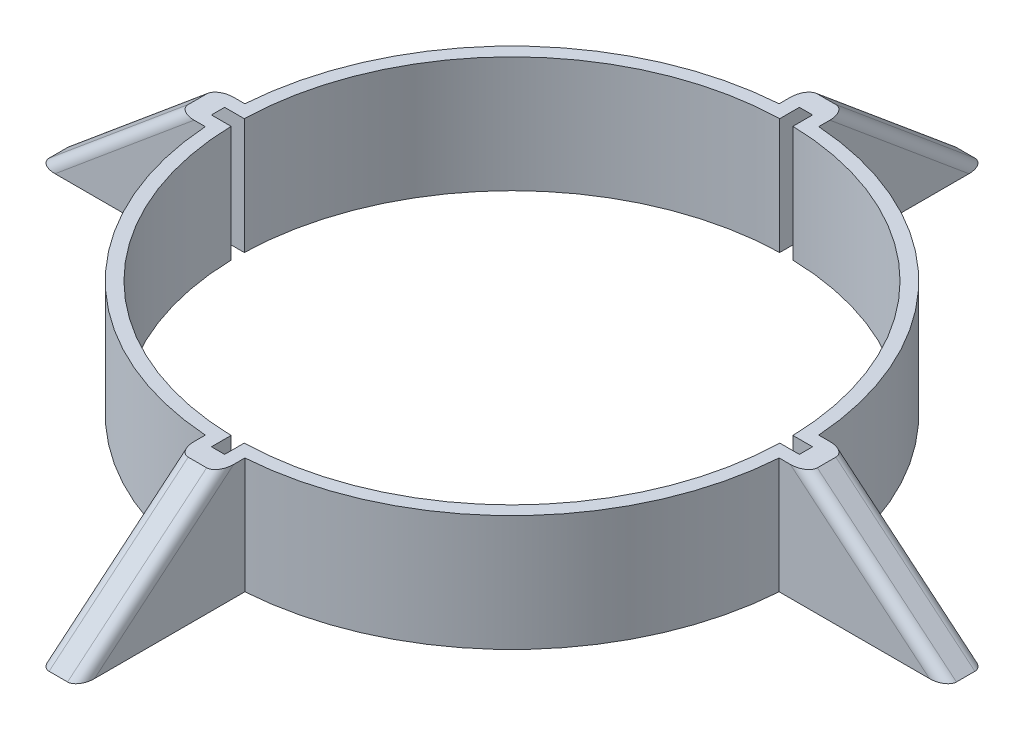
from build123d import *

# Parameters (mm, degrees)
SKETCH4_R                      = 69.215
SKETCH4_R_2                    = 66.04
BOSS_EXTRUDE3_DEPTH            = 114.3
CUT_EXTRUDE3_REACH             = 152.486
CUT_EXTRUDE3_END_RADIUS        = 69.215
SKETCH11_W                     = 3.175
SKETCH11_H                     = 203.2
CUT_EXTRUDE3_DIRECTION_2_DEPTH = 151.485622071
CUT_EXTRUDE4_REACH             = 152.486
CUT_EXTRUDE4_END_RADIUS        = 69.215
SKETCH12_W                     = 3.175
SKETCH12_H                     = 203.2
CUT_EXTRUDE5_REACH             = 152.486
CUT_EXTRUDE5_END_RADIUS        = 69.215
SKETCH13_W                     = 3.175
SKETCH13_H                     = 203.2
BOSS_EXTRUDE4_REACH            = 184.577
BOSS_EXTRUDE4_END_RADIUS       = 69.215
SKETCH17_W                     = 9.525
SKETCH17_H                     = 62.726737768
CUT_EXTRUDE6_REACH             = 184.577
CUT_EXTRUDE6_END_RADIUS        = 66.04
SKETCH19_W                     = 3.175
SKETCH19_H                     = 59.551737768
CIRPATTERN1_COUNT              = 4
FILLET2_R                      = 2.54
CUT_EXTRUDE9_DEPTH             = 193.329009636
CUT_EXTRUDE9_DEPTH_BACK        = 193.329009636
SKETCH21_W                     = 275.590003483
SKETCH21_H                     = 18.263028837
SKETCH21_H_2                   = 74.818808086


with BuildPart() as part:
    # Sketch4 → Boss-Extrude3 (new body)
    with BuildSketch(Plane(origin=(0, 0, 0), x_dir=(1, 0, 0), z_dir=(0, 1, 0))):
        with Locations(Location((0, 0, 0), (0, 0, 270))):
            Circle(SKETCH4_R)
        with Locations(Location((0, 0, 0), (0, 0, 270))):
            Circle(SKETCH4_R_2, mode=Mode.SUBTRACT)
    extrude(amount=BOSS_EXTRUDE3_DEPTH)

    # Cut-Extrude3: up to this cylinder (the profile starts inside it)
    cut_extrude3_end = Plane(origin=(0, 0, 0), z_dir=(0, -1, 0)) * Cylinder(CUT_EXTRUDE3_END_RADIUS, 444.402, mode=Mode.PRIVATE)
    # Sketch11 → Cut-Extrude3 (cut, up to the surface)
    with BuildSketch(Plane.XY, mode=Mode.PRIVATE) as cut_extrude3_sk1:
        Rectangle(SKETCH11_W, SKETCH11_H)
    cut_extrude3_tool1 = extrude(cut_extrude3_sk1.sketch, amount=-CUT_EXTRUDE3_REACH, mode=Mode.PRIVATE) & cut_extrude3_end
    add(cut_extrude3_tool1.solids().sort_by_distance((0, 0, 0))[0], mode=Mode.SUBTRACT)

    # Sketch11 → Cut-Extrude3 direction 2 (cut)
    with BuildSketch(Plane.XY):
        Rectangle(SKETCH11_W, SKETCH11_H)
    extrude(amount=CUT_EXTRUDE3_DIRECTION_2_DEPTH, mode=Mode.SUBTRACT)

    # Cut-Extrude4: up to this cylinder (the profile starts inside it)
    cut_extrude4_end = Plane(origin=(0, 0, 0), z_dir=(0, -1, 0)) * Cylinder(CUT_EXTRUDE4_END_RADIUS, 444.402, mode=Mode.PRIVATE)
    # Sketch12 → Cut-Extrude4 (cut, up to the surface)
    with BuildSketch(Plane(origin=(0, 0, 0), x_dir=(0, 0, -1), z_dir=(1, 0, 0)), mode=Mode.PRIVATE) as cut_extrude4_sk1:
        Rectangle(SKETCH12_W, SKETCH12_H)
    cut_extrude4_tool1 = extrude(cut_extrude4_sk1.sketch, amount=-CUT_EXTRUDE4_REACH, mode=Mode.PRIVATE) & cut_extrude4_end
    add(cut_extrude4_tool1.solids().sort_by_distance((0, 0, 0))[0], mode=Mode.SUBTRACT)

    # Cut-Extrude5: up to this cylinder (the profile starts inside it)
    cut_extrude5_end = Plane(origin=(0, 0, 0), z_dir=(0, -1, 0)) * Cylinder(CUT_EXTRUDE5_END_RADIUS, 444.402, mode=Mode.PRIVATE)
    # Sketch13 → Cut-Extrude5 (cut, up to the surface)
    with BuildSketch(Plane(origin=(0, 0, 0), x_dir=(0, 0, -1), z_dir=(1, 0, 0)), mode=Mode.PRIVATE) as cut_extrude5_sk1:
        Rectangle(SKETCH13_W, SKETCH13_H)
    cut_extrude5_tool1 = extrude(cut_extrude5_sk1.sketch, amount=CUT_EXTRUDE5_REACH, mode=Mode.PRIVATE) & cut_extrude5_end
    add(cut_extrude5_tool1.solids().sort_by_distance((0, 0, 0))[0], mode=Mode.SUBTRACT)

    # Boss-Extrude4: up to this cylinder (the profile starts outside it)
    boss_extrude4_end = Plane(origin=(0, 49.492455, 0), z_dir=(0, -1, 0)) * Cylinder(BOSS_EXTRUDE4_END_RADIUS, 508.584, mode=Mode.PRIVATE)
    # Sketch17 → Boss-Extrude4 (add, up to the surface)
    with BuildSketch(Plane(origin=(28.35077692, -23.629361026, 0), x_dir=(0, 0, -1), z_dir=(0.7681717916741627, -0.6402437805056029, 0)), mode=Mode.PRIVATE) as boss_extrude4_sk1:
        with Locations((0, 95.18940566)):
            Rectangle(SKETCH17_W, SKETCH17_H)
    boss_extrude4_tool1 = extrude(boss_extrude4_sk1.sketch, amount=-BOSS_EXTRUDE4_REACH, mode=Mode.PRIVATE) - boss_extrude4_end
    boss_extrude4 = boss_extrude4_tool1.solids().sort_by_distance((89.295202, 49.492455, 0))[0]
    add(boss_extrude4)

    # Cut-Extrude6: up to this cylinder (the profile starts outside it)
    cut_extrude6_end = Plane(origin=(0, 48.272983, 0), z_dir=(0, -1, 0)) * Cylinder(CUT_EXTRUDE6_END_RADIUS, 502.234, mode=Mode.PRIVATE)
    # Sketch19 → Cut-Extrude6 (cut, up to the surface)
    with BuildSketch(Plane(origin=(28.35077692, -23.629361026, 0), x_dir=(0, 0, -1), z_dir=(0.7681717916741628, -0.640243780505603, 0)), mode=Mode.PRIVATE) as cut_extrude6_sk1:
        with Locations((0, 93.60190566)):
            Rectangle(SKETCH19_W, SKETCH19_H)
    cut_extrude6_tool1 = extrude(cut_extrude6_sk1.sketch, amount=-CUT_EXTRUDE6_REACH, mode=Mode.PRIVATE) - cut_extrude6_end
    cut_extrude6 = cut_extrude6_tool1.solids().sort_by_distance((88.278815, 48.272983, 0))[0]
    add(cut_extrude6, mode=Mode.SUBTRACT)

    # CirPattern1: Boss-Extrude4, Cut-Extrude6 ×4 about axis
    cirpattern1_axis = Axis((0, 0, 0), (0, 1, 0))
    add([boss_extrude4.rotate(cirpattern1_axis, i * 360 / CIRPATTERN1_COUNT) for i in range(1, CIRPATTERN1_COUNT)])
    add([cut_extrude6.rotate(cirpattern1_axis, i * 360 / CIRPATTERN1_COUNT) for i in range(1, CIRPATTERN1_COUNT)], mode=Mode.SUBTRACT)

    # Fillet2
    # the kernel refuses this fillet: 2.54 mm, written as the material it takes off along each edge
    with BuildSketch(Plane(origin=(4.7625, 20.522109123, -65.149451994), x_dir=(-1, 0, 0), z_dir=(0, 0.7681717916741628, -0.640243780505603))) as fillet2_piece_1_section:
        with BuildLine():
            CenterArc((FILLET2_R, FILLET2_R), FILLET2_R, 180, 90)
            Line((0, FILLET2_R), (0, 0))
            Line((0, 0), (FILLET2_R, 0))
        make_face()
    fillet2_piece_1 = extrude(amount=75.426737768, mode=Mode.PRIVATE)
    fillet2_piece_1 = fillet2_piece_1 - Plane(origin=(0, 52.481761508, 0), x_dir=(0, 0, 1), z_dir=(0, -1, 0)) * Cylinder(69.215, 162, mode=Mode.PRIVATE)
    add(fillet2_piece_1, mode=Mode.SUBTRACT)
    with BuildSketch(Plane(origin=(4.7625, 69.519362531, -114.253294604), x_dir=(0, -0.7681717916741627, 0.640243780505603), z_dir=(0, 0.640243780505603, 0.7681717916741628))) as fillet2_piece_2_section:
        with BuildLine():
            CenterArc((FILLET2_R, -FILLET2_R), FILLET2_R, 90, 90)
            Line((0, -FILLET2_R), (0, 0))
            Line((0, 0), (FILLET2_R, 0))
        make_face()
    fillet2_piece_2 = extrude(amount=65.194046298, mode=Mode.PRIVATE)
    fillet2_piece_2 = fillet2_piece_2 - Plane(origin=(0, 87.751002434, 0), x_dir=(0, 0, 1), z_dir=(0, -1, 0)) * Cylinder(69.215, 141, mode=Mode.PRIVATE)
    add(fillet2_piece_2, mode=Mode.SUBTRACT)
    with BuildSketch(Plane(origin=(-4.7625, 78.462801414, -113.440951733), x_dir=(1, 0, 0), z_dir=(0, -0.7681717916741628, 0.640243780505603))) as fillet2_piece_3_section:
        with BuildLine():
            CenterArc((FILLET2_R, FILLET2_R), FILLET2_R, 180, 90)
            Line((0, FILLET2_R), (0, 0))
            Line((0, 0), (FILLET2_R, 0))
        make_face()
    fillet2_piece_3 = extrude(amount=75.426737768, mode=Mode.PRIVATE)
    fillet2_piece_3 = fillet2_piece_3 - Plane(origin=(0, 52.481717746, 0), x_dir=(0, 0, 1), z_dir=(0, -1, 0)) * Cylinder(69.215, 162, mode=Mode.PRIVATE)
    add(fillet2_piece_3, mode=Mode.SUBTRACT)
    with BuildSketch(Plane(origin=(-4.7625, 69.519362531, -114.253294604), x_dir=(1, 0, 0), z_dir=(0, 0.640243780505603, 0.7681717916741628))) as fillet2_piece_4_section:
        with BuildLine():
            CenterArc((FILLET2_R, -FILLET2_R), FILLET2_R, 90, 90)
            Line((0, -FILLET2_R), (0, 0))
            Line((0, 0), (FILLET2_R, 0))
        make_face()
    fillet2_piece_4 = extrude(amount=65.194046298, mode=Mode.PRIVATE)
    fillet2_piece_4 = fillet2_piece_4 - Plane(origin=(0, 87.75098251, 0), x_dir=(0, 0, 1), z_dir=(0, -1, 0)) * Cylinder(69.215, 141, mode=Mode.PRIVATE)
    add(fillet2_piece_4, mode=Mode.SUBTRACT)
    with BuildSketch(Plane(origin=(-113.440951733, 78.462801414, 4.7625), x_dir=(0.7681717916741627, 0.640243780505603, 0), z_dir=(0.640243780505603, -0.7681717916741628, 0))) as fillet2_piece_5_section:
        with BuildLine():
            CenterArc((FILLET2_R, -FILLET2_R), FILLET2_R, 90, 90)
            Line((0, -FILLET2_R), (0, 0))
            Line((0, 0), (FILLET2_R, 0))
        make_face()
    fillet2_piece_5 = extrude(amount=75.426737768, mode=Mode.PRIVATE)
    fillet2_piece_5 = fillet2_piece_5 - Plane(origin=(0, 52.481803849, 0), x_dir=(0, 0, 1), z_dir=(0, -1, 0)) * Cylinder(69.215, 162, mode=Mode.PRIVATE)
    add(fillet2_piece_5, mode=Mode.SUBTRACT)
    with BuildSketch(Plane(origin=(-65.149451994, 20.522109123, -4.7625), x_dir=(0.7681717916741627, 0.6402437805056029, 0), z_dir=(-0.640243780505603, 0.7681717916741628, 0))) as fillet2_piece_6_section:
        with BuildLine():
            CenterArc((FILLET2_R, -FILLET2_R), FILLET2_R, 90, 90)
            Line((0, -FILLET2_R), (0, 0))
            Line((0, 0), (FILLET2_R, 0))
        make_face()
    fillet2_piece_6 = extrude(amount=75.426737768, mode=Mode.PRIVATE)
    fillet2_piece_6 = fillet2_piece_6 - Plane(origin=(0, 52.481712427, 0), x_dir=(0, 0, 1), z_dir=(0, -1, 0)) * Cylinder(69.215, 162, mode=Mode.PRIVATE)
    add(fillet2_piece_6, mode=Mode.SUBTRACT)
    with BuildSketch(Plane(origin=(-114.253294604, 69.519362531, -4.7625), x_dir=(0.640243780505603, -0.7681717916741627, 0), z_dir=(0.7681717916741628, 0.640243780505603, 0))) as fillet2_piece_7_section:
        with BuildLine():
            CenterArc((FILLET2_R, -FILLET2_R), FILLET2_R, 90, 90)
            Line((0, -FILLET2_R), (0, 0))
            Line((0, 0), (FILLET2_R, 0))
        make_face()
    fillet2_piece_7 = extrude(amount=65.194046298, mode=Mode.PRIVATE)
    fillet2_piece_7 = fillet2_piece_7 - Plane(origin=(0, 87.75099738, 0), x_dir=(0, 0, 1), z_dir=(0, -1, 0)) * Cylinder(69.215, 141, mode=Mode.PRIVATE)
    add(fillet2_piece_7, mode=Mode.SUBTRACT)
    with BuildSketch(Plane(origin=(-114.253294604, 69.519362531, 4.7625), x_dir=(0, 0, -1), z_dir=(0.7681717916741628, 0.640243780505603, 0))) as fillet2_piece_8_section:
        with BuildLine():
            CenterArc((FILLET2_R, -FILLET2_R), FILLET2_R, 90, 90)
            Line((0, -FILLET2_R), (0, 0))
            Line((0, 0), (FILLET2_R, 0))
        make_face()
    fillet2_piece_8 = extrude(amount=65.194046298, mode=Mode.PRIVATE)
    fillet2_piece_8 = fillet2_piece_8 - Plane(origin=(0, 87.75098251, 0), x_dir=(0, 0, 1), z_dir=(0, -1, 0)) * Cylinder(69.215, 141, mode=Mode.PRIVATE)
    add(fillet2_piece_8, mode=Mode.SUBTRACT)
    with BuildSketch(Plane(origin=(4.7625, 78.462801414, 113.440951733), x_dir=(0, 0.640243780505603, -0.7681717916741628), z_dir=(0, -0.7681717916741628, -0.640243780505603))) as fillet2_piece_9_section:
        with BuildLine():
            CenterArc((FILLET2_R, -FILLET2_R), FILLET2_R, 90, 90)
            Line((0, -FILLET2_R), (0, 0))
            Line((0, 0), (FILLET2_R, 0))
        make_face()
    fillet2_piece_9 = extrude(amount=75.426737768, mode=Mode.PRIVATE)
    fillet2_piece_9 = fillet2_piece_9 - Plane(origin=(0, 52.48180385, 0), x_dir=(0, 0, 1), z_dir=(0, -1, 0)) * Cylinder(69.215, 162, mode=Mode.PRIVATE)
    add(fillet2_piece_9, mode=Mode.SUBTRACT)
    with BuildSketch(Plane(origin=(-4.7625, 20.522109123, 65.149451994), x_dir=(0, 0.640243780505603, -0.7681717916741628), z_dir=(0, 0.7681717916741628, 0.640243780505603))) as fillet2_piece_10_section:
        with BuildLine():
            CenterArc((FILLET2_R, -FILLET2_R), FILLET2_R, 90, 90)
            Line((0, -FILLET2_R), (0, 0))
            Line((0, 0), (FILLET2_R, 0))
        make_face()
    fillet2_piece_10 = extrude(amount=75.426737768, mode=Mode.PRIVATE)
    fillet2_piece_10 = fillet2_piece_10 - Plane(origin=(0, 52.481712427, 0), x_dir=(0, 0, 1), z_dir=(0, -1, 0)) * Cylinder(69.215, 162, mode=Mode.PRIVATE)
    add(fillet2_piece_10, mode=Mode.SUBTRACT)
    with BuildSketch(Plane(origin=(-4.7625, 69.519362531, 114.253294604), x_dir=(0, -0.7681717916741627, -0.640243780505603), z_dir=(0, 0.640243780505603, -0.7681717916741628))) as fillet2_piece_11_section:
        with BuildLine():
            CenterArc((FILLET2_R, -FILLET2_R), FILLET2_R, 90, 90)
            Line((0, -FILLET2_R), (0, 0))
            Line((0, 0), (FILLET2_R, 0))
        make_face()
    fillet2_piece_11 = extrude(amount=65.194046298, mode=Mode.PRIVATE)
    fillet2_piece_11 = fillet2_piece_11 - Plane(origin=(0, 87.750997379, 0), x_dir=(0, 0, 1), z_dir=(0, -1, 0)) * Cylinder(69.215, 141, mode=Mode.PRIVATE)
    add(fillet2_piece_11, mode=Mode.SUBTRACT)
    with BuildSketch(Plane(origin=(4.7625, 69.519362531, 114.253294604), x_dir=(-1, 0, 0), z_dir=(0, 0.640243780505603, -0.7681717916741628))) as fillet2_piece_12_section:
        with BuildLine():
            CenterArc((FILLET2_R, -FILLET2_R), FILLET2_R, 90, 90)
            Line((0, -FILLET2_R), (0, 0))
            Line((0, 0), (FILLET2_R, 0))
        make_face()
    fillet2_piece_12 = extrude(amount=65.194046298, mode=Mode.PRIVATE)
    fillet2_piece_12 = fillet2_piece_12 - Plane(origin=(0, 87.750982502, 0), x_dir=(0, 0, 1), z_dir=(0, -1, 0)) * Cylinder(69.215, 141, mode=Mode.PRIVATE)
    add(fillet2_piece_12, mode=Mode.SUBTRACT)
    with BuildSketch(Plane(origin=(114.253294604, 69.519362531, -4.7625), x_dir=(-0.6402437805056029, -0.7681717916741627, 0), z_dir=(-0.7681717916741628, 0.640243780505603, 0))) as fillet2_piece_13_section:
        with BuildLine():
            CenterArc((FILLET2_R, FILLET2_R), FILLET2_R, 180, 90)
            Line((0, FILLET2_R), (0, 0))
            Line((0, 0), (FILLET2_R, 0))
        make_face()
    fillet2_piece_13 = extrude(amount=65.194046298, mode=Mode.PRIVATE)
    fillet2_piece_13 = fillet2_piece_13 - Plane(origin=(0, 87.750998227, 0), x_dir=(0, 0, 1), z_dir=(0, -1, 0)) * Cylinder(69.215, 141, mode=Mode.PRIVATE)
    add(fillet2_piece_13, mode=Mode.SUBTRACT)
    with BuildSketch(Plane(origin=(114.253294604, 69.519362531, 4.7625), x_dir=(0, 0, -1), z_dir=(-0.7681717916741628, 0.640243780505603, 0))) as fillet2_piece_14_section:
        with BuildLine():
            CenterArc((FILLET2_R, FILLET2_R), FILLET2_R, 180, 90)
            Line((0, FILLET2_R), (0, 0))
            Line((0, 0), (FILLET2_R, 0))
        make_face()
    fillet2_piece_14 = extrude(amount=65.194046298, mode=Mode.PRIVATE)
    fillet2_piece_14 = fillet2_piece_14 - Plane(origin=(0, 87.7510067, 0), x_dir=(0, 0, 1), z_dir=(0, -1, 0)) * Cylinder(69.215, 141, mode=Mode.PRIVATE)
    add(fillet2_piece_14, mode=Mode.SUBTRACT)
    with BuildSketch(Plane(origin=(65.149451994, 20.522109123, 4.7625), x_dir=(-0.7681717916741627, 0.6402437805056029, 0), z_dir=(0.640243780505603, 0.7681717916741628, 0))) as fillet2_piece_15_section:
        with BuildLine():
            CenterArc((FILLET2_R, -FILLET2_R), FILLET2_R, 90, 90)
            Line((0, -FILLET2_R), (0, 0))
            Line((0, 0), (FILLET2_R, 0))
        make_face()
    fillet2_piece_15 = extrude(amount=75.426737768, mode=Mode.PRIVATE)
    fillet2_piece_15 = fillet2_piece_15 - Plane(origin=(0, 52.481781271, 0), x_dir=(0, 0, 1), z_dir=(0, -1, 0)) * Cylinder(69.215, 162, mode=Mode.PRIVATE)
    add(fillet2_piece_15, mode=Mode.SUBTRACT)
    with BuildSketch(Plane(origin=(113.440951733, 78.462801414, -4.7625), x_dir=(-0.7681717916741627, 0.640243780505603, 0), z_dir=(-0.640243780505603, -0.7681717916741628, 0))) as fillet2_piece_16_section:
        with BuildLine():
            CenterArc((FILLET2_R, -FILLET2_R), FILLET2_R, 90, 90)
            Line((0, -FILLET2_R), (0, 0))
            Line((0, 0), (FILLET2_R, 0))
        make_face()
    fillet2_piece_16 = extrude(amount=75.426737768, mode=Mode.PRIVATE)
    fillet2_piece_16 = fillet2_piece_16 - Plane(origin=(0, 52.481835587, 0), x_dir=(0, 0, 1), z_dir=(0, -1, 0)) * Cylinder(69.215, 162, mode=Mode.PRIVATE)
    add(fillet2_piece_16, mode=Mode.SUBTRACT)

    # Sketch21 → Cut-Extrude9 (cut, two sides: drawn at the far end of the back side and taken through both)
    with BuildSketch(Plane(origin=(0, 0, 0), x_dir=(0, 0, -1), z_dir=(1, 0, 0)).offset(-CUT_EXTRUDE9_DEPTH_BACK)):
        with Locations((2.764773941, 110.779336526)):
            Rectangle(SKETCH21_W, SKETCH21_H)
        with Locations((2.764773941, 36.337367755)):
            Rectangle(SKETCH21_W, SKETCH21_H_2)
    extrude(amount=CUT_EXTRUDE9_DEPTH + CUT_EXTRUDE9_DEPTH_BACK, mode=Mode.SUBTRACT)


solid = part.part
